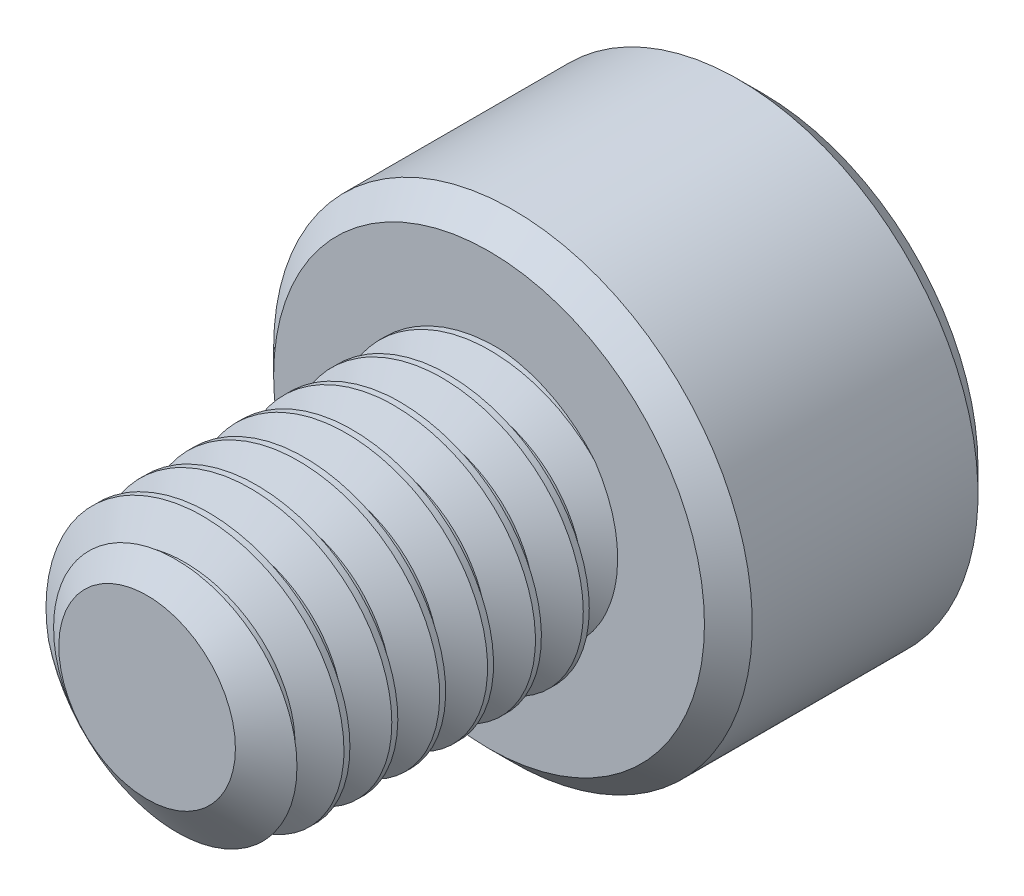
from build123d import *

# Parameters (mm, degrees)
SKETCH1_R          = 2
EXTRUDE1_DEPTH     = 5
CUT_SWEEP1_PITCH   = 0.7
SKETCH6_R          = 3.5
EXTRUDE2_DEPTH     = 4
CUT_EXTRUDE1_DEPTH = 2.25
CHAMFER1_SIZE      = 0.35


with BuildPart() as part:
    # Sketch1 → Extrude1 (new body)
    with BuildSketch(Plane.XY):
        Circle(SKETCH1_R)
    extrude(amount=-EXTRUDE1_DEPTH)

    # Cut-Sweep1: the profile of Sketch3 profile screwed along a right-hand helix of 8.142857 turns, 6 arcs to a turn; built about Z, then put on its axis
    cut_sweep1_z = Axis((0, 0, 0), (0, 0, 1))
    cut_sweep1_corners = [(2.0003, 0, -0.612673205), (1.545336663, 0, -0.35), (1.545336663, 0, -0.2625), (2.0003, 0, 0.000173205)]
    with BuildLine(mode=Mode.PRIVATE) as cut_sweep1_profile:
        Line(cut_sweep1_corners[0], cut_sweep1_corners[1])
        Line(cut_sweep1_corners[1], cut_sweep1_corners[2])
        Line(cut_sweep1_corners[2], cut_sweep1_corners[3])
        Line(cut_sweep1_corners[3], cut_sweep1_corners[0])
    cut_sweep1_cap = Face(cut_sweep1_profile.wire())
    cut_sweep1_turn_angles = [0, 30, 60, 90, 120, 150, 180, 210, 240, 270, 300, 330, 360]
    cut_sweep1_turn_weights = [1, 0.8660254037844387, 1, 0.8660254037844387, 1, 0.8660254037844387, 1, 0.8660254037844387, 1, 0.8660254037844387, 1, 0.8660254037844387, 1]
    cut_sweep1_turn_rails = [Edge.make_bspline([Vector(p[0], p[1], 0).rotate(cut_sweep1_z, cut_sweep1_turn_angles[k]) / cut_sweep1_turn_weights[k] + Vector(0, 0, p[2] + CUT_SWEEP1_PITCH * cut_sweep1_turn_angles[k] / 360) for k in range(13)], [0, 0, 0, 1, 1, 2, 2, 3, 3, 4, 4, 5, 5, 6, 6, 6], 2, cut_sweep1_turn_weights) for p in cut_sweep1_corners]
    cut_sweep1_turn_sides = [Face.make_surface_from_curves(cut_sweep1_turn_rails[p[0]], cut_sweep1_turn_rails[p[1]]) for p in [(0, 1), (1, 2), (2, 3), (3, 0)]]
    cut_sweep1_last_angles = [2880, 2905.714285714, 2931.428571429]
    cut_sweep1_last_weights = [1, 0.9009688679023722, 1]
    cut_sweep1_last_rails = [Edge.make_bspline([Vector(p[0], p[1], 0).rotate(cut_sweep1_z, cut_sweep1_last_angles[k]) / cut_sweep1_last_weights[k] + Vector(0, 0, p[2] + CUT_SWEEP1_PITCH * cut_sweep1_last_angles[k] / 360) for k in range(3)], [0, 0, 0, 1, 1, 1], 2, cut_sweep1_last_weights) for p in cut_sweep1_corners]
    cut_sweep1_last_sides = [Face.make_surface_from_curves(cut_sweep1_last_rails[p[0]], cut_sweep1_last_rails[p[1]]) for p in [(0, 1), (1, 2), (2, 3), (3, 0)]]
    cut_sweep1 = Plane(origin=(0, 0, 0), x_dir=(0, 1, 0), z_dir=(0, 0, -1)) * Solid(Shell([*[p.moved(Location((0, 0, CUT_SWEEP1_PITCH * i))) for i in range(8) for p in cut_sweep1_turn_sides], *cut_sweep1_last_sides, cut_sweep1_cap, cut_sweep1_cap.rotate(cut_sweep1_z, 2931.428571429).moved(Location((0, 0, CUT_SWEEP1_PITCH * 2931.428571429 / 360)))]))
    add(cut_sweep1, mode=Mode.SUBTRACT)

    # Sketch4 → Cut-Revolve1 (revolve, cut)
    with BuildSketch(Plane(origin=(0, 0, 0), x_dir=(0, 0, -1), z_dir=(1, 0, 0)), mode=Mode.PRIVATE) as cut_revolve1_sk:
        Polygon((0.496211411, 2), (0, 1.291336663), (0, 2), align=None)
    revolve(cut_revolve1_sk.sketch.rotate(Axis((0, 0, 0), (0, 0, -1)), 271.401126896), axis=Axis((0, 0, 0), (0, 0, -1)), mode=Mode.SUBTRACT)

    # Sketch6 → Extrude2 (add)
    with BuildSketch(Plane(origin=(0, 0, -5), x_dir=(-1, 0, 0), z_dir=(0, 0, -1))):
        Circle(SKETCH6_R)
    extrude(amount=EXTRUDE2_DEPTH)

    # Sketch7 → Cut-Extrude1 (cut)
    with BuildSketch(Plane(origin=(0, 0, -9), x_dir=(-1, 0, 0), z_dir=(0, 0, -1))):
        Polygon((0, 1.732050808), (-1.5, 0.866025404), (-1.5, -0.866025404), (0, -1.732050808), (1.5, -0.866025404), (1.5, 0.866025404), align=None)
    extrude(amount=-CUT_EXTRUDE1_DEPTH, mode=Mode.SUBTRACT)

    # Cut-Extrude2 cone 1 section (through the dimple's axis) → Cut-Extrude2 (revolve, cut)
    with BuildSketch(Plane(origin=(0, 0, -9), x_dir=(0, 1, 0), z_dir=(1, 0, 0))):
        Polygon((0, 0), (1.732050808, 0), (0, 1.732050808), align=None)
    revolve(axis=Axis((0, 0, -9), (0, 0, 1)), mode=Mode.SUBTRACT)

    # Chamfer1
    chamfer1_edges = [part.edges().sort_by_distance(p)[0] for p in [
        (3.5, 0, -5),
        (3.5, 0, -9),
    ]]
    chamfer(chamfer1_edges, length=CHAMFER1_SIZE)


solid = part.part
